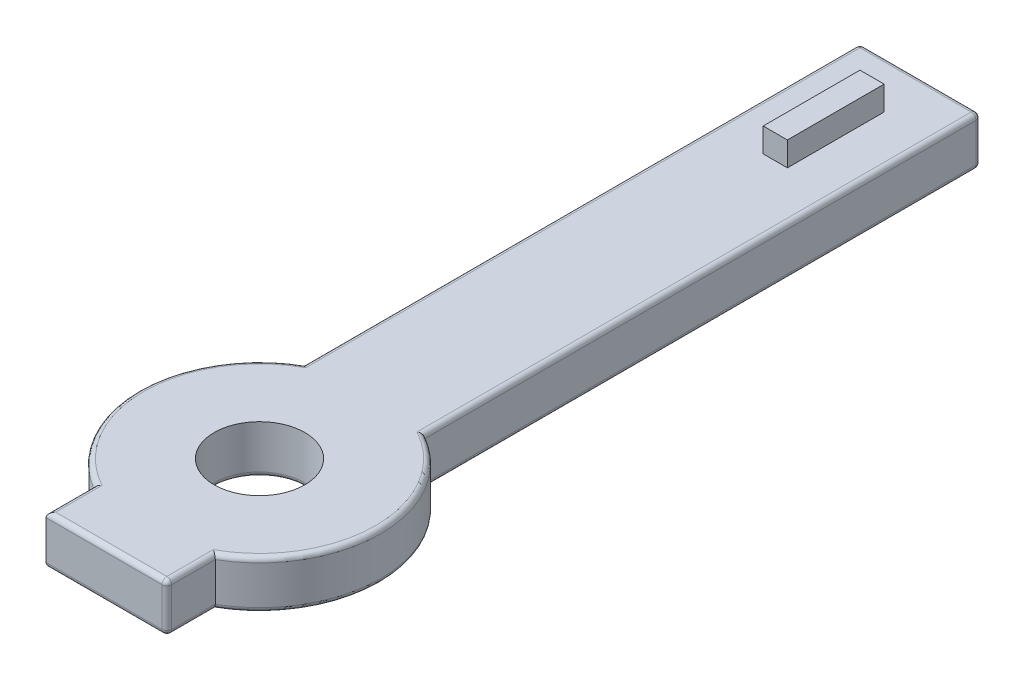
from build123d import *

# Parameters (mm, degrees)
SKETCH_1_R      = 1.875
EXTRUDE_1_DEPTH = 2
SKETCH_2_W      = 1
SKETCH_2_H      = 4
EXTRUDE_2_DEPTH = 1
FILLET_1_R      = 0.2


with BuildPart() as part:
    # 草图1 → 凸台-拉伸1 (new body)
    with BuildSketch(Plane(origin=(0, 0, 0), x_dir=(1, 0, 0), z_dir=(0, 1, 0))):
        with BuildLine():
            Line((2.5, 27.330127019), (-2.5, 27.330127019))
            Line((-2.5, 27.330127019), (-2.5, 4.330127019))
            ThreePointArc((-2.5, 4.330127019), (-5, 0), (-2.5, -4.330127019))
            Line((-2.5, -4.330127019), (-2.5, -6.330127019))
            Line((-2.5, -6.330127019), (2.5, -6.330127019))
            Line((2.5, -6.330127019), (2.5, -4.330127019))
            ThreePointArc((2.5, -4.330127019), (5, 0), (2.5, 4.330127019))
            Line((2.5, 4.330127019), (2.5, 27.330127019))
        make_face()
        Circle(SKETCH_1_R, mode=Mode.SUBTRACT)
    extrude(amount=EXTRUDE_1_DEPTH)

    # 草图2 → 凸台-拉伸2 (add)
    with BuildSketch(Plane(origin=(0, 2, 0), x_dir=(1, 0, 0), z_dir=(0, 1, 0))):
        with Locations((0, 23.330127019)):
            Rectangle(SKETCH_2_W, SKETCH_2_H)
    extrude(amount=EXTRUDE_2_DEPTH)

    # 圆角1
    fillet_1_edges = [part.edges().sort_by_distance(p)[0] for p in [
        (-1.875, 0, 0),
        (2.5, 0, -15.830127019),
        (0, 0, -27.330127019),
        (-2.5, 0, -15.830127019),
        (-5, 0, 0),
        (-2.5, 0, 5.330127019),
        (0, 0, 6.330127019),
        (2.5, 0, 5.330127019),
        (5, 0, 0),
        (2.5, 2, 5.330127019),
        (0, 2, 6.330127019),
        (-2.5, 2, 5.330127019),
        (-5, 2, 0),
        (-2.5, 2, -15.830127019),
        (0, 2, -27.330127019),
        (2.5, 2, -15.830127019),
        (5, 2, 0),
        (2.5, 1, 6.330127019),
        (-2.5, 1, -27.330127019),
        (2.5, 1, -27.330127019),
    ]]
    fillet(fillet_1_edges, radius=FILLET_1_R)


solid = part.part
